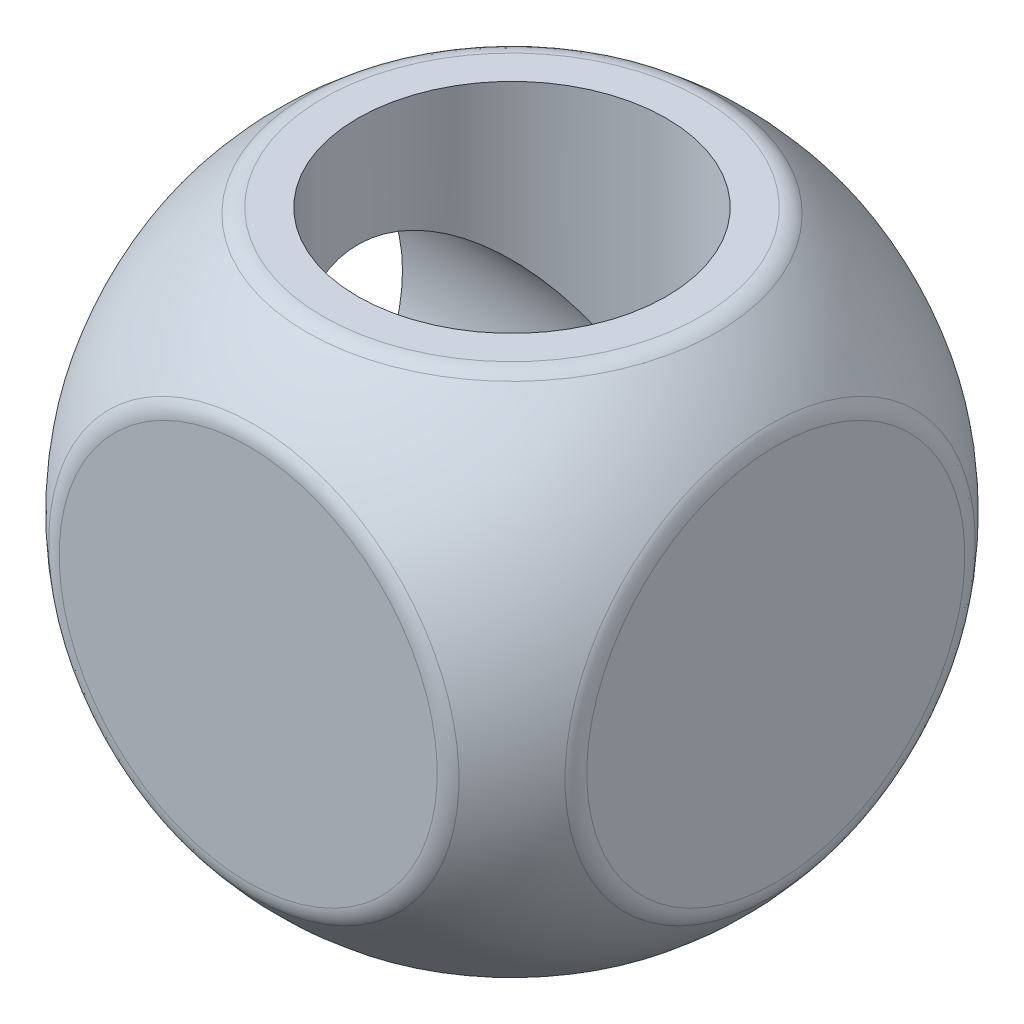
from build123d import *

# Parameters (mm, degrees)
R_P_TITION_START                   = -7.62
R_P_TITION_CIRCULAIRE5_OUTLINE_W   = 3.84
R_P_TITION_CIRCULAIRE5_OUTLINE_H   = 18
R_P_TITION_CIRCULAIRE5_DEPTH       = 15.24
R_P_TITION_START_2                 = -12.7
R_P_TITION_CIRCULAIRE5_2_OUTLINE_W = 19.16
R_P_TITION_CIRCULAIRE5_2_OUTLINE_H = 18
R_P_TITION_CIRCULAIRE5_2_DEPTH     = 2.54
R_P_TITION_START_3                 = 10.16
R_P_TITION_CIRCULAIRE5_3_OUTLINE_W = 19.16
R_P_TITION_CIRCULAIRE5_3_OUTLINE_H = 18
R_P_TITION_CIRCULAIRE5_3_DEPTH     = 2.54
R_P_TITION_CIRCULAIRE6_OUTLINE_W   = 18
R_P_TITION_CIRCULAIRE6_OUTLINE_H   = 18
R_P_TITION_CIRCULAIRE6_DEPTH       = 2.54
R_P_TITION_CIRCULAIRE6_2_OUTLINE_W = 18
R_P_TITION_CIRCULAIRE6_2_OUTLINE_H = 18
R_P_TITION_CIRCULAIRE6_2_DEPTH     = 2.54
CONG_1_R                           = 1
R_P_TITION_CIRCULAIRE7_COUNT       = 3
R_P_TITION_CIRCULAIRE7_ANGLE       = 180


# Read off the part's stored shape, not the designer's step: Répétition circulaire5, Répétition circulaire6
with BuildPart() as part:
    # Esquisse1 → Révolution1 (revolve)
    with BuildSketch(Plane.XY):
        with BuildLine():
            Line((0, -12.7), (0, 12.7))
            ThreePointArc((0, 12.7), (12.7, 0), (0, -12.7))
        make_face()
    revolve(axis=Axis((0, -12.7, 0), (0, 1, 0)))

    # Enlèv. mat.-Surface1
    split(bisect_by=Plane(origin=(0, 10.16, 0), x_dir=(1, 0, 0), z_dir=(0, 1, 0)), keep=Keep.BOTTOM)

    # Répétition circulaire5 outline → Répétition circulaire5 (cut)
    with BuildSketch(Plane.YZ.offset(R_P_TITION_START)):
        with Locations((-12.08, 0)):
            Rectangle(R_P_TITION_CIRCULAIRE5_OUTLINE_W, R_P_TITION_CIRCULAIRE5_OUTLINE_H)
    extrude(amount=R_P_TITION_CIRCULAIRE5_DEPTH, mode=Mode.SUBTRACT)

    # R_p_tition circulaire5 2 outline → R_p_tition circulaire5 2 (cut)
    with BuildSketch(Plane.YZ.offset(R_P_TITION_START_2)):
        with Locations((-0.58, 0)):
            Rectangle(R_P_TITION_CIRCULAIRE5_2_OUTLINE_W, R_P_TITION_CIRCULAIRE5_2_OUTLINE_H)
    extrude(amount=R_P_TITION_CIRCULAIRE5_2_DEPTH, mode=Mode.SUBTRACT)

    # R_p_tition circulaire5 3 outline → R_p_tition circulaire5 3 (cut)
    with BuildSketch(Plane.YZ.offset(R_P_TITION_START_3)):
        with Locations((-0.58, 0)):
            Rectangle(R_P_TITION_CIRCULAIRE5_3_OUTLINE_W, R_P_TITION_CIRCULAIRE5_3_OUTLINE_H)
    extrude(amount=R_P_TITION_CIRCULAIRE5_3_DEPTH, mode=Mode.SUBTRACT)

    # Répétition circulaire6 outline → Répétition circulaire6 (cut)
    with BuildSketch(Plane.XY.offset(R_P_TITION_START_2)):
        Rectangle(R_P_TITION_CIRCULAIRE6_OUTLINE_W, R_P_TITION_CIRCULAIRE6_OUTLINE_H)
    extrude(amount=R_P_TITION_CIRCULAIRE6_DEPTH, mode=Mode.SUBTRACT)

    # R_p_tition circulaire6 2 outline → R_p_tition circulaire6 2 (cut)
    with BuildSketch(Plane.XY.offset(R_P_TITION_START_3)):
        Rectangle(R_P_TITION_CIRCULAIRE6_2_OUTLINE_W, R_P_TITION_CIRCULAIRE6_2_OUTLINE_H)
    extrude(amount=R_P_TITION_CIRCULAIRE6_2_DEPTH, mode=Mode.SUBTRACT)

    # Congé1
    cong_1_edges = [part.edges().sort_by_distance(p)[0] for p in [
        (-10.16, 0, -7.62),
        (-7.62, -10.16, 0),
        (10.16, 0, -7.62),
        (0, 7.62, -10.16),
        (0, 7.62, 10.16),
        (-7.62, 10.16, 0),
    ]]
    fillet(cong_1_edges, radius=CONG_1_R)

    # Esquisse2 → Trou taraudé 1/4-18 NPSM1 (revolve, cut)
    with BuildSketch(Plane(origin=(0, 10.16, 0), x_dir=(0, 0, 1), z_dir=(1, 0, 0))):
        Polygon((0, 0), (0, 16.271275175), (5.9436, 12.7), (5.9436, 0), align=None)
    trou_taraud_1_4_18_npsm1 = revolve(axis=Axis((0, 16.51, 0), (0, -1, 0)), mode=Mode.SUBTRACT)

    # Répétition circulaire7: Trou taraudé 1/4-18 NPSM1 ×3 about axis
    r_p_tition_circulaire7_axis = Axis((0, 0, -11.176), (0, 0, 1))
    for i in range(1, R_P_TITION_CIRCULAIRE7_COUNT):
        add(trou_taraud_1_4_18_npsm1.rotate(r_p_tition_circulaire7_axis, i * R_P_TITION_CIRCULAIRE7_ANGLE / (R_P_TITION_CIRCULAIRE7_COUNT - 1)), mode=Mode.SUBTRACT)


solid = part.part
